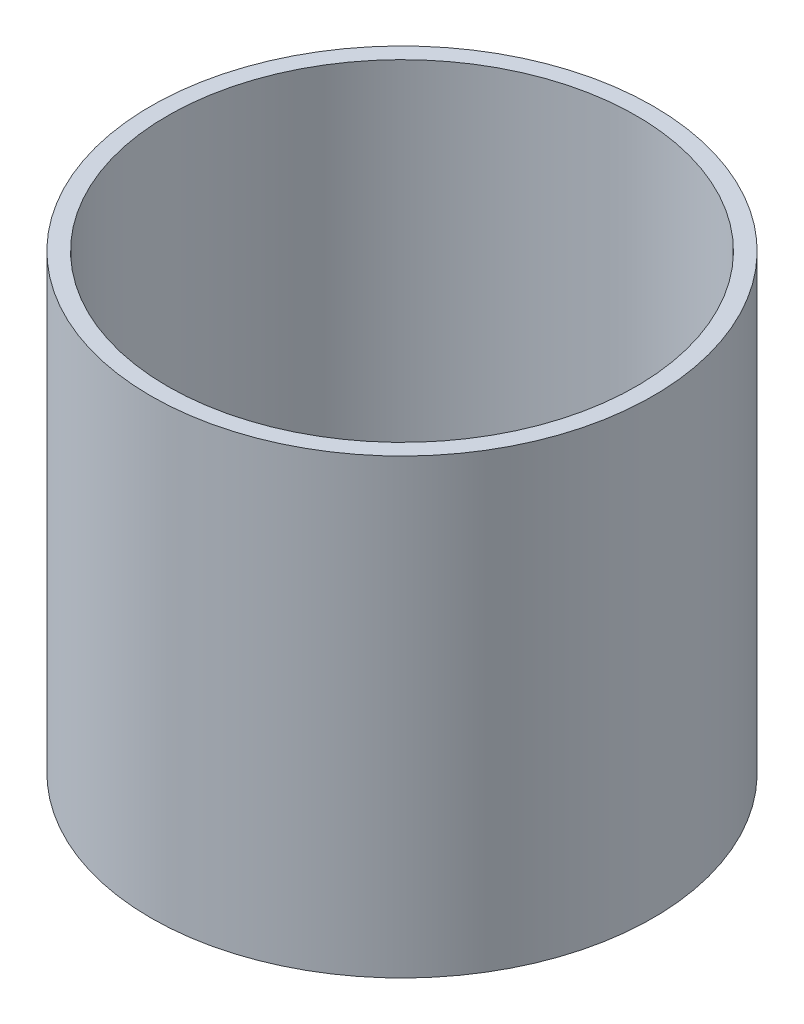
from build123d import *

# Parameters (mm, degrees)
SKETCH1_R           = 22.5
SKETCH1_R_2         = 21
BOSS_EXTRUDE1_DEPTH = 35.5
BOSS_EXTRUDE2_START = 5
SKETCH2_R           = 22.5
BOSS_EXTRUDE2_DEPTH = 5


with BuildPart() as part:
    # Sketch1 → Boss-Extrude1 (new body)
    with BuildSketch(Plane(origin=(0, 0, 0), x_dir=(1, 0, 0), z_dir=(0, 1, 0))):
        Circle(SKETCH1_R)
        Circle(SKETCH1_R_2, mode=Mode.SUBTRACT)
    extrude(amount=BOSS_EXTRUDE1_DEPTH)

    # Sketch2 → Boss-Extrude2 (add)
    with BuildSketch(Plane.XZ.offset(BOSS_EXTRUDE2_START)):
        Circle(SKETCH2_R)
    extrude(amount=-BOSS_EXTRUDE2_DEPTH)


solid = part.part
